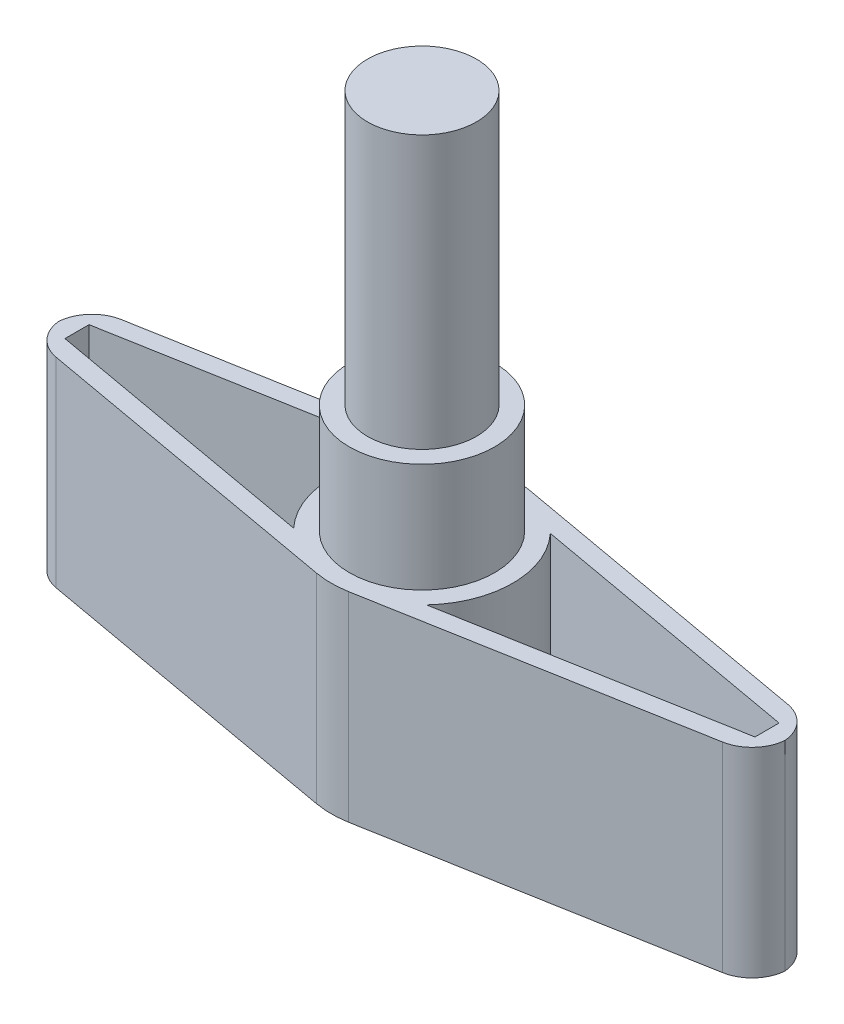
from build123d import *

# Parameters (mm, degrees)
BOSS_EXTRUDE1_DEPTH = 10
BOSS_EXTRUDE2_START = 1
BOSS_EXTRUDE2_DEPTH = 1
SKETCH3_R           = 4
BOSS_EXTRUDE3_DEPTH = 6
SKETCH4_R           = 3
BOSS_EXTRUDE4_DEPTH = 15
FILLET1_R           = 2


with BuildPart() as part:
    # Sketch1 → Boss-Extrude1 (new body)
    with BuildSketch(Plane(origin=(0, 0, 0), x_dir=(1, 0, 0), z_dir=(0, 1, 0))):
        with BuildLine():
            Line((-20.000157194, 1.500878546), (-20.000157194, -1.500878546))
            Line((-20.000157194, -1.500878546), (-0.880639137, -4.921836518))
            ThreePointArc((-0.880639137, -4.921836518), (0, -5), (0.880639137, -4.921836518))
            Line((0.880639137, -4.921836518), (20.000157194, -1.500878546))
            Line((20.000157194, -1.500878546), (20.000157194, 1.500878546))
            Line((20.000157194, 1.500878546), (0.880639137, 4.921836518))
            ThreePointArc((0.880639137, 4.921836518), (0, 5), (-0.880639137, 4.921836518))
            Line((-0.880639137, 4.921836518), (-20.000157194, 1.500878546))
        make_face()
        with BuildLine():
            Line((-19.000157194, -0.663922493), (-19.000157194, 0.663922493))
            Line((-19.000157194, 0.663922493), (-18.824029366, 0.695436148))
            Line((-18.824029366, 0.695436148), (-3.65761322, 3.409085733))
            ThreePointArc((-3.65761322, 3.409085733), (-5, 0), (-3.65761322, -3.409085733))
            Line((-3.65761322, -3.409085733), (-18.824029366, -0.695436148))
            Line((-18.824029366, -0.695436148), (-19.000157194, -0.663922493))
        make_face(mode=Mode.SUBTRACT)
        with BuildLine():
            Line((18.824029366, 0.695436148), (19.000157194, 0.663922493))
            Line((19.000157194, 0.663922493), (19.000157194, -0.663922493))
            Line((19.000157194, -0.663922493), (18.824029366, -0.695436148))
            Line((18.824029366, -0.695436148), (3.65761322, -3.409085733))
            ThreePointArc((3.65761322, -3.409085733), (5, 0), (3.65761322, 3.409085733))
            Line((3.65761322, 3.409085733), (18.824029366, 0.695436148))
        make_face(mode=Mode.SUBTRACT)
    extrude(amount=BOSS_EXTRUDE1_DEPTH)

    # Sketch2 → Boss-Extrude2 (add)
    with BuildSketch(Plane.XZ.offset(BOSS_EXTRUDE2_START)):
        with BuildLine():
            Line((-20.000157194, 1.500878546), (-0.880639137, 4.921836518))
            ThreePointArc((-0.880639137, 4.921836518), (0, 5), (0.880639137, 4.921836518))
            Line((0.880639137, 4.921836518), (20.000157194, 1.500878546))
            Line((20.000157194, 1.500878546), (20.000157194, -1.500878546))
            Line((20.000157194, -1.500878546), (0.880639137, -4.921836518))
            ThreePointArc((0.880639137, -4.921836518), (0, -5), (-0.880639137, -4.921836518))
            Line((-0.880639137, -4.921836518), (-20.000157194, -1.500878546))
            Line((-20.000157194, -1.500878546), (-20.000157194, 1.500878546))
        make_face()
    extrude(amount=-BOSS_EXTRUDE2_DEPTH)

    # Sketch3 → Boss-Extrude3 (add)
    with BuildSketch(Plane(origin=(0, 10, 0), x_dir=(1, 0, 0), z_dir=(0, 1, 0))):
        with Locations(Location((0, 0, 0), (0, 0, 270))):
            Circle(SKETCH3_R)
    extrude(amount=BOSS_EXTRUDE3_DEPTH)

    # Sketch4 → Boss-Extrude4 (add)
    with BuildSketch(Plane(origin=(0, 16, 0), x_dir=(1, 0, 0), z_dir=(0, 1, 0))):
        with Locations(Location((0, 0, 0), (0, 0, 270))):
            Circle(SKETCH4_R)
    extrude(amount=BOSS_EXTRUDE4_DEPTH)

    # Fillet1
    # the kernel refuses this fillet: 2 mm, written as the material it takes off along each edge
    with BuildSketch(Plane(origin=(20.000157194, -5.184780263, 1.500878546), x_dir=(-0.9843673036221247, 0, 0.17612782732920945), z_dir=(0, 1, 0)), Plane(origin=(20.000157194, -5.184780263, -1.500878546), x_dir=(0, 0, 1), z_dir=(0, 1, 0)), Plane(origin=(-20.000157194, 14.184780263, 1.500878546), x_dir=(0.9843673036221245, 0, 0.17612782732920956), z_dir=(0, -1, 0))) as fillet1_piece_1:
        with BuildLine():
            CenterArc((FILLET1_R * 0.836956052521, -FILLET1_R), FILLET1_R, 90, 79.855702636)
            Line((-FILLET1_R * 0.147411251101, -FILLET1_R * 0.823872172671), (0, 0))
            Line((0, 0), (FILLET1_R * 0.836956052521, 0))
        make_face()
    extrude(amount=19.369560525, mode=Mode.SUBTRACT)
    with BuildSketch(Plane(origin=(-20.000157194, -5.184780263, -1.500878546), x_dir=(0, 0, 1), z_dir=(0, 1, 0))) as fillet1_piece_2:
        with BuildLine():
            CenterArc((FILLET1_R * 0.836956052521, FILLET1_R), FILLET1_R, 190.144297364, 79.855702636)
            Line((-FILLET1_R * 0.147411251101, FILLET1_R * 0.823872172671), (0, 0))
            Line((0, 0), (FILLET1_R * 0.836956052521, 0))
        make_face()
    extrude(amount=19.369560525, mode=Mode.SUBTRACT)


solid = part.part
